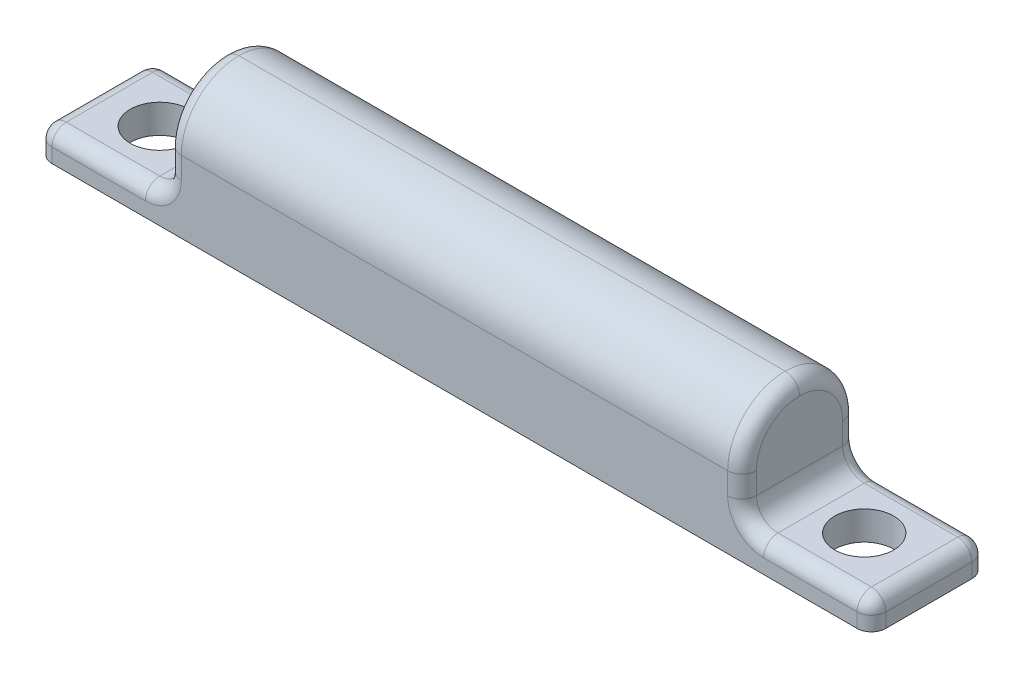
from build123d import *

# Parameters (mm, degrees)
SKETCH1_W           = 40
SKETCH1_H           = 8
SKETCH1_W_2         = 9
SKETCH1_R           = 2.05
BOSS_EXTRUDE1_DEPTH = 2
SKETCH1_3_W         = 40
SKETCH1_3_H         = 8
BOSS_EXTRUDE2_DEPTH = 9
FILLET1_R           = 4
FILLET2_R           = 1
FILLET4_R           = 1.5
FILLET5_R           = 1


with BuildPart() as part:
    # Sketch1 → Boss-Extrude1 (new body)
    # profile 1 of 3: a face of its own
    with BuildSketch(Plane(origin=(0, 0, 0), x_dir=(1, 0, 0), z_dir=(0, 1, 0))):
        with Locations((29, -4)):
            Rectangle(SKETCH1_W, SKETCH1_H)
    # profile 2 of 3: a face of its own
    with BuildSketch(Plane(origin=(0, 0, 0), x_dir=(1, 0, 0), z_dir=(0, 1, 0))):
        with Locations((4.5, -4)):
            Rectangle(SKETCH1_W_2, SKETCH1_H)
        with Locations(Location((4.5, -4, 0), (0, 0, 270))):
            Circle(SKETCH1_R, mode=Mode.SUBTRACT)
    # profile 3 of 3: a face of its own
    with BuildSketch(Plane(origin=(0, 0, 0), x_dir=(1, 0, 0), z_dir=(0, 1, 0))):
        with Locations((53.5, -4)):
            Rectangle(SKETCH1_W_2, SKETCH1_H)
        with Locations(Location((53.5, -4, 0), (0, 0, 270))):
            Circle(SKETCH1_R, mode=Mode.SUBTRACT)
    extrude(amount=BOSS_EXTRUDE1_DEPTH)

    # Sketch1<3> → Boss-Extrude2 (add)
    with BuildSketch(Plane(origin=(0, 0, 0), x_dir=(1, 0, 0), z_dir=(0, 1, 0))):
        with Locations((29, -4)):
            Rectangle(SKETCH1_3_W, SKETCH1_3_H)
    extrude(amount=BOSS_EXTRUDE2_DEPTH)

    # Fillet1
    fillet1_edges = [part.edges().sort_by_distance(p)[0] for p in [
        (29, 9, 0),
        (29, 9, 8),
    ]]
    fillet(fillet1_edges, radius=FILLET1_R - 0.0001)  # a hair under: the kernel refuses the full size

    # Fillet2
    fillet2_edges = [part.edges().sort_by_distance(p)[0] for p in [
        (0, 1, 8),
        (0, 1, 0),
        (58, 1, 0),
        (58, 1, 8),
    ]]
    fillet(fillet2_edges, radius=FILLET2_R)

    # Fillet4
    fillet4_edges = [part.edges().sort_by_distance(p)[0] for p in [
        (9, 2, 4),
        (49, 2, 4),
    ]]
    fillet(fillet4_edges, radius=FILLET4_R)

    # Fillet5
    fillet5_edges = [part.edges().sort_by_distance(p)[0] for p in [
        (9, 4.25005, 0),
        (49, 4.25005, 0),
        (49, 4.25005, 8),
        (49, 7.828456414, 6.828456414),
        (49, 7.828456414, 1.171543586),
        (9, 4.25005, 8),
        (9, 7.828456414, 6.828456414),
        (9, 7.828456414, 1.171543586),
        (4.25, 2, 0),
        (58, 2, 4),
        (57.707106781, 2, 7.707106781),
        (57.707106781, 2, 0.292893219),
        (4.25, 2, 8),
        (0, 2, 4),
        (0.292893219, 2, 7.707106781),
        (0.292893219, 2, 0.292893219),
        (53.75, 2, 0),
        (53.75, 2, 8),
        (49.439339828, 2.439339828, 0),
        (49.439339828, 2.439339828, 8),
        (8.560660172, 2.439339828, 0),
        (8.560660172, 2.439339828, 8),
    ]]
    fillet(fillet5_edges, radius=FILLET5_R)


solid = part.part
